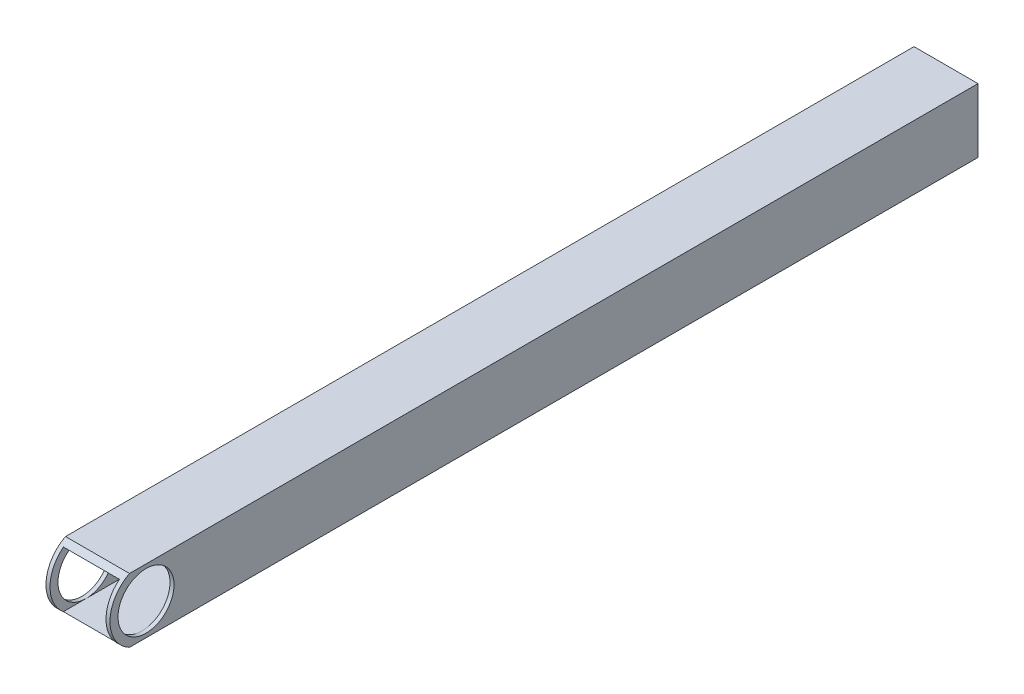
from build123d import *

# Parameters (mm, degrees)
SKETCH1_W           = 25.4
SKETCH1_H           = 25.4
SKETCH1_W_2         = 22.225
SKETCH1_H_2         = 22.225
EXTRUDE_THIN1_DEPTH = 174.625
SKETCH2_R           = 11.1125
CUT_EXTRUDE1_DEPTH  = 177.91902279
CUT_EXTRUDE2_DEPTH  = 177.91902279


with BuildPart() as part:
    # Sketch1 → Extrude-Thin1 (new, symmetric)
    with BuildSketch(Plane.XY):
        Rectangle(SKETCH1_W, SKETCH1_H)
        Rectangle(SKETCH1_W_2, SKETCH1_H_2, mode=Mode.SUBTRACT)
    extrude(amount=EXTRUDE_THIN1_DEPTH, both=True)

    # Sketch2 → Cut-Extrude1 (cut, through all)
    with BuildSketch(Plane(origin=(12.7, 0, 0), x_dir=(0, 0, -1), z_dir=(1, 0, 0))):
        with Locations((-155.575, 0)):
            Circle(SKETCH2_R)
    extrude(amount=-CUT_EXTRUDE1_DEPTH, mode=Mode.SUBTRACT)

    # Sketch3 → Cut-Extrude2 (cut, through all)
    with BuildSketch(Plane(origin=(12.7, 0, 0), x_dir=(0, 0, -1), z_dir=(1, 0, 0))):
        with BuildLine():
            Line((-155.575, 14.2875), (-174.625, 14.2875))
            Line((-174.625, 14.2875), (-174.625, -12.7))
            Line((-174.625, -12.7), (-162.120430181, -12.7))
            ThreePointArc((-162.120430181, -12.7), (-169.4599542, 3.367596045), (-155.575, 14.2875))
        make_face()
    extrude(amount=-CUT_EXTRUDE2_DEPTH, mode=Mode.SUBTRACT)


solid = part.part
